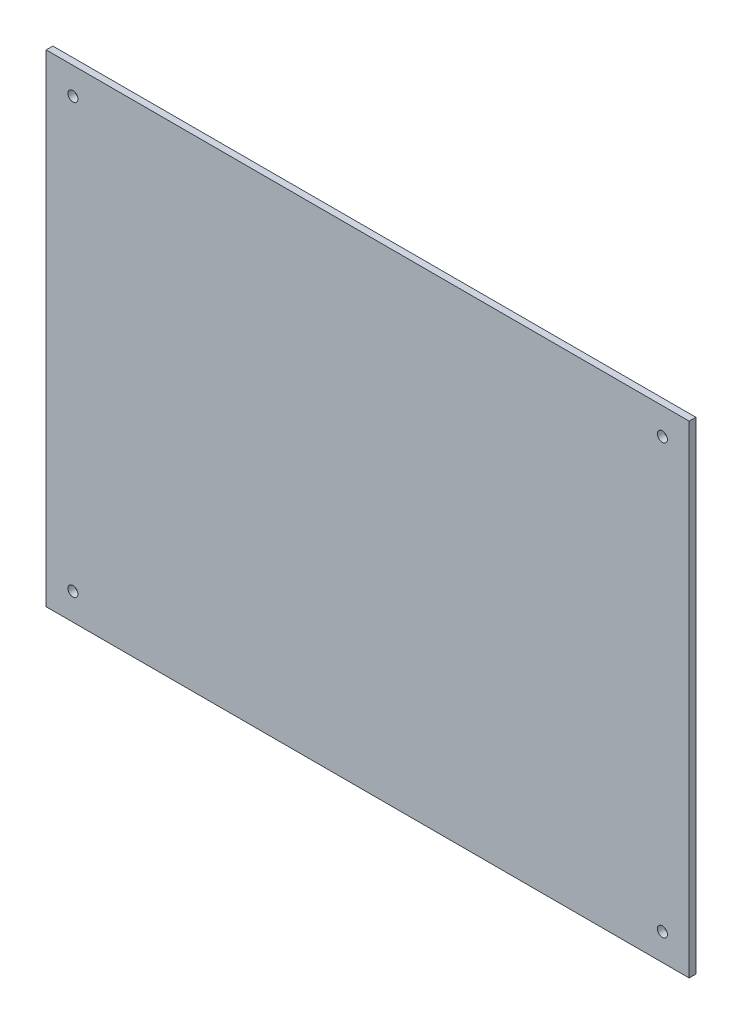
from build123d import *

# Parameters (mm, degrees)
SKETCH1_W           = 304.8
SKETCH1_H           = 228.6
SKETCH1_R           = 2.38125
BOSS_EXTRUDE1_DEPTH = 3.175


with BuildPart() as part:
    # Sketch1 → Boss-Extrude1 (new body)
    with BuildSketch(Plane.XY):
        Rectangle(SKETCH1_W, SKETCH1_H)
        with Locations((139.7, 101.6)):
            Circle(SKETCH1_R, mode=Mode.SUBTRACT)
        with Locations((-139.7, 101.6)):
            Circle(SKETCH1_R, mode=Mode.SUBTRACT)
        with Locations((-139.7, -101.6)):
            Circle(SKETCH1_R, mode=Mode.SUBTRACT)
        with Locations((139.7, -101.6)):
            Circle(SKETCH1_R, mode=Mode.SUBTRACT)
    extrude(amount=BOSS_EXTRUDE1_DEPTH)


solid = part.part
